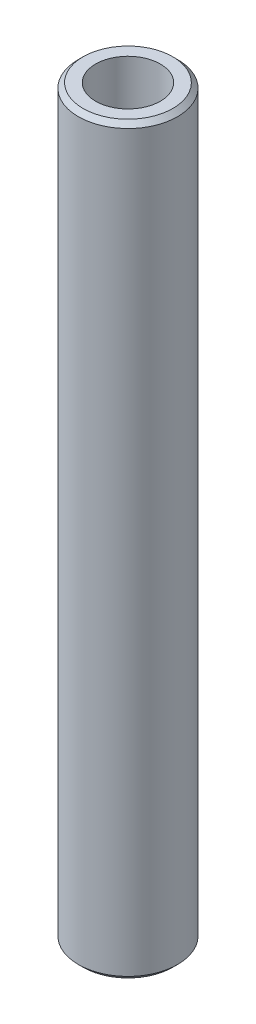
from build123d import *

# Parameters (mm, degrees)
SKETCH1_R           = 40
BOSS_EXTRUDE1_DEPTH = 600
SKETCH2_R           = 26.080449136
CUT_EXTRUDE1_DEPTH  = 603.660766933
CHAMFER1_SIZE       = 3.821286148


with BuildPart() as part:
    # Sketch1 → Boss-Extrude1 (new body)
    with BuildSketch(Plane(origin=(0, 0, 0), x_dir=(1, 0, 0), z_dir=(0, 1, 0))):
        Circle(SKETCH1_R)
    extrude(amount=BOSS_EXTRUDE1_DEPTH)

    # Sketch2 → Cut-Extrude1 (cut, through all)
    with BuildSketch(Plane(origin=(0, 0, 0), x_dir=(1, 0, 0), z_dir=(0, 1, 0))):
        Circle(SKETCH2_R)
    extrude(amount=CUT_EXTRUDE1_DEPTH, mode=Mode.SUBTRACT)

    # Chamfer1
    chamfer1_edges = [part.edges().sort_by_distance(p)[0] for p in [
        (-40, 600, 0),
        (-40, 0, 0),
    ]]
    chamfer(chamfer1_edges, length=CHAMFER1_SIZE)


solid = part.part
